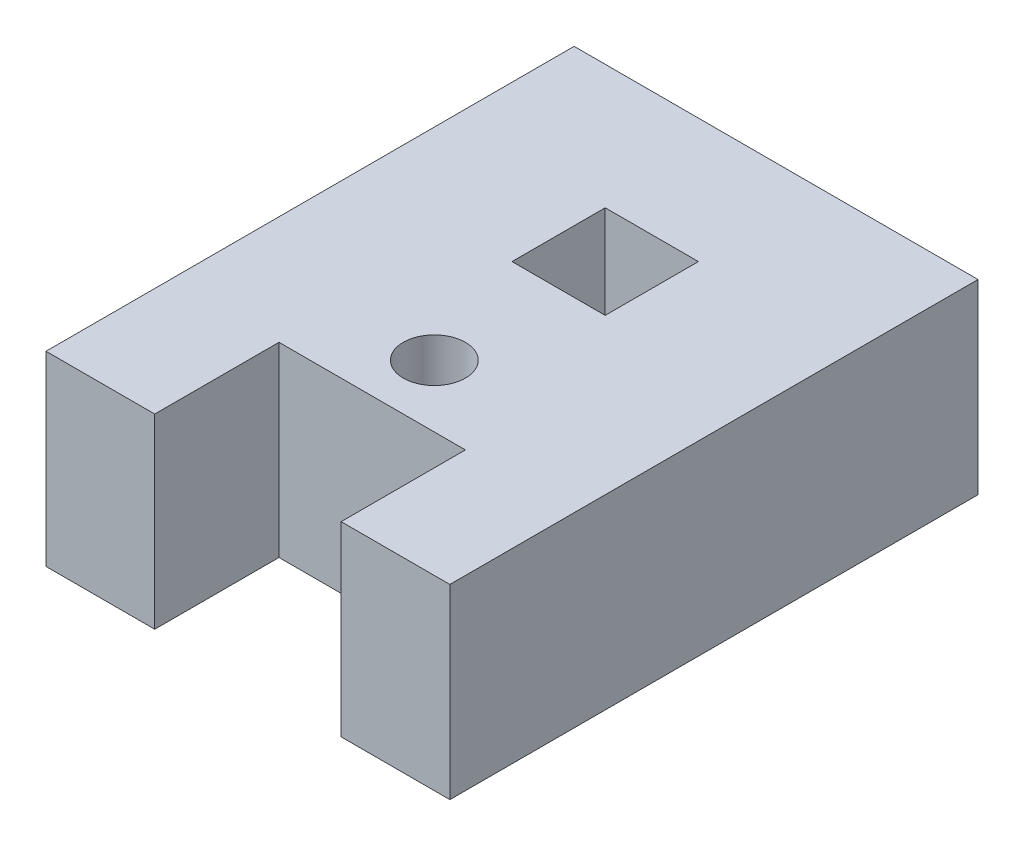
from build123d import *

# Parameters (mm, degrees)
BOSS_EXTRUDE1_DEPTH = 6
SKETCH2_R           = 1
SKETCH2_W           = 3
SKETCH2_H           = 3
CUT_EXTRUDE1_DEPTH  = 23.226110771


with BuildPart() as part:
    # Sketch1 → Boss-Extrude1 (new body)
    with BuildSketch(Plane(origin=(0, 0, 0), x_dir=(1, 0, 0), z_dir=(0, 1, 0))):
        Polygon((3.5, 0), (3.5, 4), (9.5, 4), (9.5, 0), (13, 0), (13, 17), (0, 17), (0, 0), align=None)
    extrude(amount=BOSS_EXTRUDE1_DEPTH)

    # Sketch2 → Cut-Extrude1 (cut, through all)
    with BuildSketch(Plane(origin=(0, 6, 0), x_dir=(1, 0, 0), z_dir=(0, 1, 0))):
        with Locations((6.5, 6)):
            Circle(SKETCH2_R)
        with Locations((6.5, 11.5)):
            Rectangle(SKETCH2_W, SKETCH2_H)
    extrude(amount=-CUT_EXTRUDE1_DEPTH, mode=Mode.SUBTRACT)


solid = part.part
